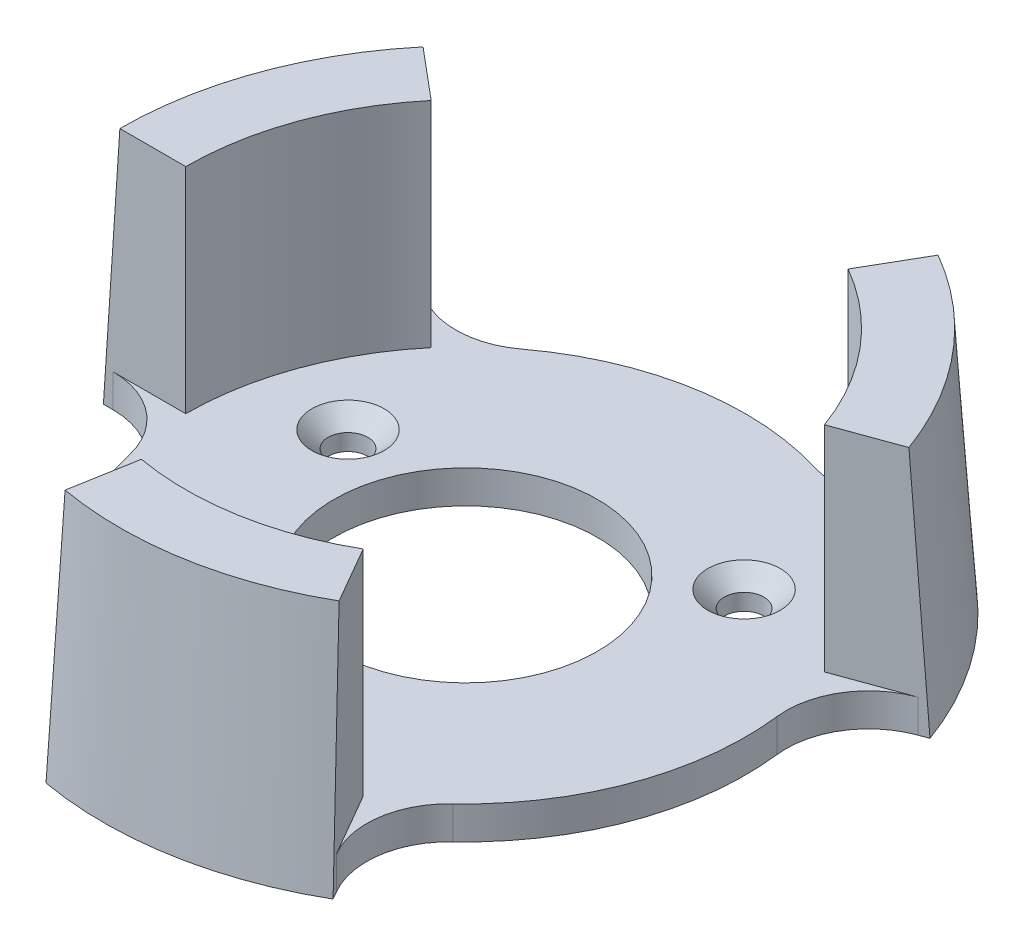
from build123d import *

# Parameters (mm, degrees)
SKETCH1_R                                    = 17
SKETCH1_R_2                                  = 8
BOSS_EXTRUDE4_DEPTH                          = 2
REVOLVE2_ANGLE                               = 40
CIRPATTERN1_COUNT                            = 3
FILLET1_R                                    = 5
CSK_FOR_M2_COUNTERSUNK_FLAT_HEAD_SCR_2_COUNT = 2
CSK_FOR_M2_COUNTERSUNK_FLAT_HEAD_SCR_2_PITCH = 20.784609691
CSK_FOR_M2_COUNTERSUNK_FLAT_HEAD_SCR_3_COUNT = 2
CSK_FOR_M2_COUNTERSUNK_FLAT_HEAD_SCR_3_PITCH = 20.747553677


with BuildPart() as part:
    # Sketch1 → Boss-Extrude4 (new body)
    with BuildSketch(Plane(origin=(0, 0, 0), x_dir=(1, 0, 0), z_dir=(0, 1, 0))):
        Circle(SKETCH1_R)
        Circle(SKETCH1_R_2, mode=Mode.SUBTRACT)
    extrude(amount=BOSS_EXTRUDE4_DEPTH)

    # Sketch5 → Revolve2 (revolve)
    with BuildSketch(Plane.XY):
        Polygon((-17, 0), (-22, 0), (-21, 15), (-17, 15), align=None)
    revolve2 = revolve(axis=Axis((0, 9.813682869, 0), (0, -1, 0)), revolution_arc=REVOLVE2_ANGLE)

    # CirPattern1: Revolve2 ×3 about axis
    cirpattern1_axis = Axis((0, 2, 0), (0, 1, 0))
    for i in range(1, CIRPATTERN1_COUNT):
        add(revolve2.rotate(cirpattern1_axis, i * 360 / CIRPATTERN1_COUNT))

    # Fillet1
    fillet1_edges = [part.edges().sort_by_distance(p)[0] for p in [
        (8.5, 1, 14.722431864),
        (15.974774553, 1, -5.814342437),
        (8.5, 1, -14.722431864),
        (-13.022755533, 1, -10.927389365),
        (-17, 1, 0),
        (-2.95201902, 1, 16.741731801),
    ]]
    fillet(fillet1_edges, radius=FILLET1_R)

    # Sketch13 → CSK for M2 Countersunk Flat Head Screw1 (revolve, cut)
    with BuildSketch(Plane(origin=(2.083778132, 2, 11.817693036), x_dir=(0, 0, 1), z_dir=(1, 0, 0))):
        Polygon((0, 0), (0, 2), (1.2, 2), (1.2, 1), (2.2, 0), align=None)
    csk_for_m2_countersunk_flat_head_screw1 = revolve(axis=Axis((2.083778132, 8.35, 11.817693036), (0, -1, 0)), mode=Mode.SUBTRACT)

    # CSK for M2 Countersunk Flat Head Scr 2: CSK for M2 Countersunk Flat Head Screw1 ×2
    with Locations(*[Vector(0.3420201433256633, 0, -0.9396926207859104) * (i * CSK_FOR_M2_COUNTERSUNK_FLAT_HEAD_SCR_2_PITCH) for i in range(1, CSK_FOR_M2_COUNTERSUNK_FLAT_HEAD_SCR_2_COUNT)]):
        add(csk_for_m2_countersunk_flat_head_screw1, mode=Mode.SUBTRACT)

    # CSK for M2 Countersunk Flat Head Scr 3: CSK for M2 Countersunk Flat Head Screw1 ×2
    with Locations(*[Vector(-0.6419971087705412, 0, -0.7667070577021357) * (i * CSK_FOR_M2_COUNTERSUNK_FLAT_HEAD_SCR_3_PITCH) for i in range(1, CSK_FOR_M2_COUNTERSUNK_FLAT_HEAD_SCR_3_COUNT)]):
        add(csk_for_m2_countersunk_flat_head_screw1, mode=Mode.SUBTRACT)


solid = part.part
